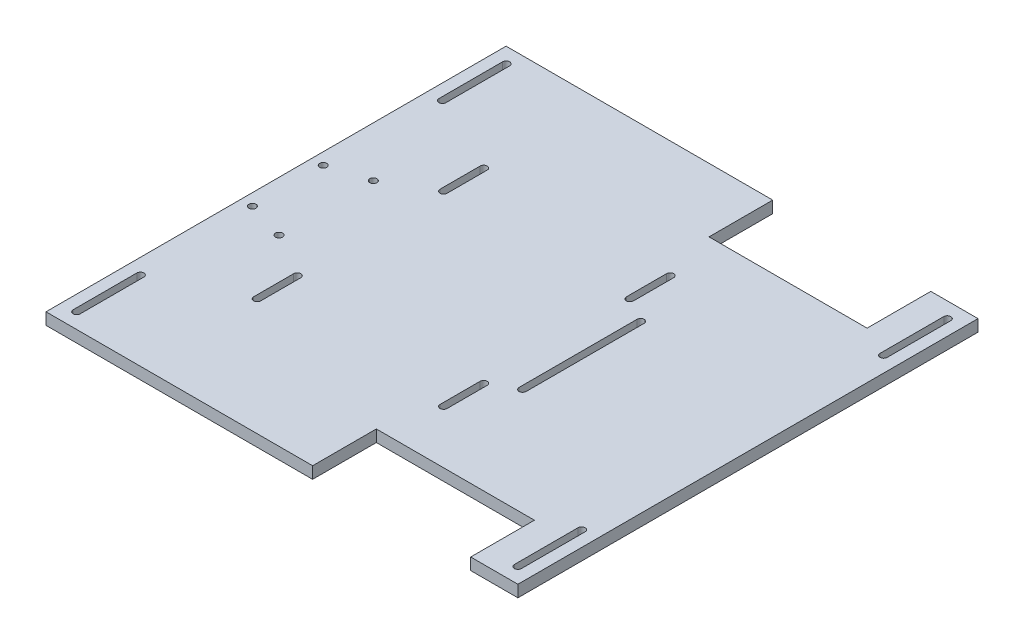
from build123d import *

# Parameters (mm, degrees)
SKETCH2_W           = 200
SKETCH2_H           = 195
BOSS_EXTRUDE1_DEPTH = 5
CUT_EXTRUDE1_DEPTH  = 140.754248594
SKETCH4_W           = 67
SKETCH4_H           = 27
CUT_EXTRUDE2_DEPTH  = 140.754248594
CUT_EXTRUDE4_DEPTH  = 140.754248594
CUT_EXTRUDE5_DEPTH  = 140.754248594
SKETCH8_R           = 1.5
CUT_EXTRUDE6_DEPTH  = 140.754248594
SKETCH9_R           = 1.5
CUT_EXTRUDE7_DEPTH  = 140.754248594


with BuildPart() as part:
    # Sketch2 → Boss-Extrude1 (new body)
    with BuildSketch(Plane(origin=(0, 0, 0), x_dir=(1, 0, 0), z_dir=(0, 1, 0))):
        Rectangle(SKETCH2_W, SKETCH2_H)
    extrude(amount=BOSS_EXTRUDE1_DEPTH)

    # Sketch3 → Cut-Extrude1 (cut, through all)
    with BuildSketch(Plane(origin=(0, 5, 0), x_dir=(1, 0, 0), z_dir=(0, 1, 0))):
        with BuildLine():
            Line((-95, -91), (-95, -64))
            ThreePointArc((-95, -64), (-93.5, -62.5), (-92, -64))
            Line((-92, -64), (-92, -91))
            ThreePointArc((-92, -91), (-93.5, -92.5), (-95, -91))
        make_face()
        with BuildLine():
            Line((-95, 91), (-95, 64))
            ThreePointArc((-95, 64), (-93.5, 62.5), (-92, 64))
            Line((-92, 64), (-92, 91))
            ThreePointArc((-92, 91), (-93.5, 92.5), (-95, 91))
        make_face()
        with BuildLine():
            Line((95, 91), (95, 64))
            ThreePointArc((95, 64), (93.5, 62.5), (92, 64))
            Line((92, 64), (92, 91))
            ThreePointArc((92, 91), (93.5, 92.5), (95, 91))
        make_face()
        with BuildLine():
            Line((95, -91), (95, -64))
            ThreePointArc((95, -64), (93.5, -62.5), (92, -64))
            Line((92, -64), (92, -91))
            ThreePointArc((92, -91), (93.5, -92.5), (95, -91))
        make_face()
    extrude(amount=-CUT_EXTRUDE1_DEPTH, mode=Mode.SUBTRACT)

    # Sketch4 → Cut-Extrude2 (cut, through all)
    with BuildSketch(Plane.XZ):
        with Locations((46.5, -84)):
            Rectangle(SKETCH4_W, SKETCH4_H)
        with Locations((46.5, 84)):
            Rectangle(SKETCH4_W, SKETCH4_H)
    extrude(amount=-CUT_EXTRUDE2_DEPTH, mode=Mode.SUBTRACT)

    # Sketch5 → Cut-Extrude4 (cut, through all)
    with BuildSketch(Plane.XZ):
        with BuildLine():
            Line((-61.5, -48), (-61.5, -31))
            ThreePointArc((-61.5, -31), (-60, -29.5), (-58.5, -31))
            Line((-58.5, -31), (-58.5, -48))
            ThreePointArc((-58.5, -48), (-60, -49.5), (-61.5, -48))
        make_face()
        with BuildLine():
            Line((-61.5, 48), (-61.5, 31))
            ThreePointArc((-61.5, 31), (-60, 29.5), (-58.5, 31))
            Line((-58.5, 31), (-58.5, 48))
            ThreePointArc((-58.5, 48), (-60, 49.5), (-61.5, 48))
        make_face()
        with BuildLine():
            Line((20.5, 48), (20.5, 31))
            ThreePointArc((20.5, 31), (19, 29.5), (17.5, 31))
            Line((17.5, 31), (17.5, 48))
            ThreePointArc((17.5, 48), (19, 49.5), (20.5, 48))
        make_face()
        with BuildLine():
            Line((20.5, -48), (20.5, -31))
            ThreePointArc((20.5, -31), (19, -29.5), (17.5, -31))
            Line((17.5, -31), (17.5, -48))
            ThreePointArc((17.5, -48), (19, -49.5), (20.5, -48))
        make_face()
    extrude(amount=-CUT_EXTRUDE4_DEPTH, mode=Mode.SUBTRACT)

    # Sketch7 → Cut-Extrude5 (cut, through all)
    with BuildSketch(Plane.XZ):
        with BuildLine():
            Line((28, -25), (28, 25))
            ThreePointArc((28, 25), (29.5, 26.5), (31, 25))
            Line((31, 25), (31, -25))
            ThreePointArc((31, -25), (29.5, -26.5), (28, -25))
        make_face()
    extrude(amount=-CUT_EXTRUDE5_DEPTH, mode=Mode.SUBTRACT)

    # Sketch8 → Cut-Extrude6 (cut, through all)
    with BuildSketch(Plane(origin=(0, 5, 0), x_dir=(1, 0, 0), z_dir=(0, 1, 0))):
        with Locations((-78.75, -19.995)):
            Circle(SKETCH8_R)
        with Locations((-78.75, 19.995)):
            Circle(SKETCH8_R)
    extrude(amount=-CUT_EXTRUDE6_DEPTH, mode=Mode.SUBTRACT)

    # Sketch9 → Cut-Extrude7 (cut, through all)
    with BuildSketch(Plane(origin=(0, 5, 0), x_dir=(1, 0, 0), z_dir=(0, 1, 0))):
        with Locations((-95, 15)):
            Circle(SKETCH9_R)
        with Locations((-95, -15)):
            Circle(SKETCH9_R)
    extrude(amount=-CUT_EXTRUDE7_DEPTH, mode=Mode.SUBTRACT)


solid = part.part
